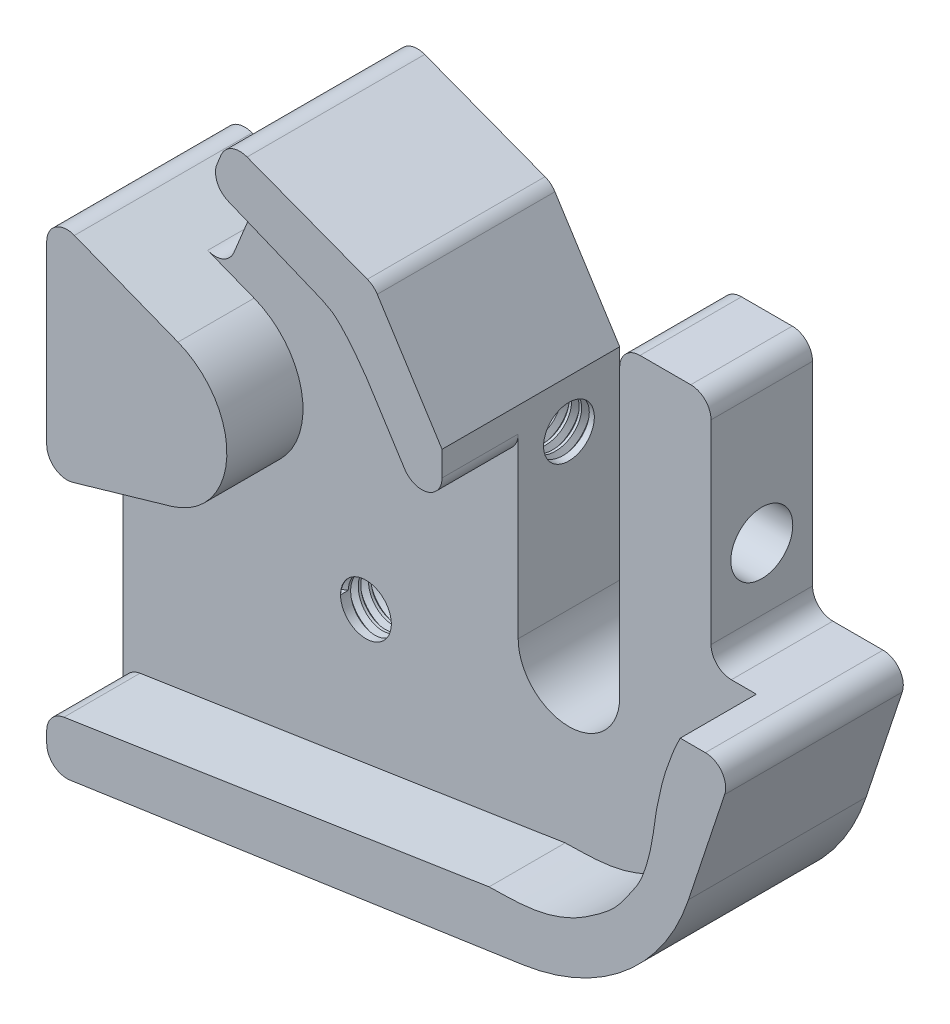
from build123d import *

# Parameters (mm, degrees)
BOSS_EXTRUDE1_DEPTH             = 10
BOSS_EXTRUDE2_DEPTH             = 17.5
SKETCH4_R                       = 3.0499999999999963
CUT_EXTRUDE2_DEPTH              = 30
TAP_DRILL_FOR_M6X1_0_TAP3_D     = 5
TAP_DRILL_FOR_M6X1_0_TAP3_DEPTH = 30
TAP_DRILL_FOR_M6X1_0_TAP3_TIP   = 1.5021515475689007
THREAD2_PITCH                   = 1
TAP_DRILL_FOR_M6X1_0_TAP4_D     = 5
TAP_DRILL_FOR_M6X1_0_TAP4_DEPTH = 30
TAP_DRILL_FOR_M6X1_0_TAP4_TIP   = 1.5021515475689007
THREAD3_PITCH                   = 1
FILLET1_R                       = 2


with BuildPart() as part:
    # Sketch1 → Boss-Extrude1 (new body)
    with BuildSketch(Plane.XY):
        with BuildLine():
            Line((78.96827475522947, 38.5935556342534), (78.96827475522947, 42.187825253742076))
            Line((78.96827475522947, 42.187825253742076), (77.94135898527813, 43.80236991179886))
            Line((77.94135898527813, 43.80236991179886), (74.33675739276399, 49.46962171171273))
            ThreePointArc((74.33675739276399, 49.469621711712726), (63.688772453091616, 32.62392036907067), (72.5745325100122, 14.785744867864917))
            Line((72.5745325100123, 14.785744867865446), (83.59996436724236, 16.48818112450211))
            add(Edge.make_bspline(
                [(83.59996436724236, 16.48818112450211), (85.41724211796232, 16.53756568760866), (87.87798883539779, 16.519220276594936), (90.67264688620305, 17.4205412675626), (92.39490917260517, 18.177313617681204), (94.09982159977741, 19.337279052052818), (95.76190532502257, 20.5841697393974), (96.83810880091103, 21.893388892292062), (97.57220809756222, 23.02149502182195), (98.2993424213877, 24.012698516640825), (98.8168110615546, 25.180735972728456), (99.338171414632, 26.79477159166982), (99.75451745291461, 28.733058812999758), (99.97921580397461, 30.8782343395527), (100.41119186805446, 32.87304752802449), (100.84339117053996, 34.69276986008277), (101.41680498340376, 36.208847575811006), (101.85717784527547, 37.44613777913256), (102.23335830846173, 38.17303090912299), (102.42203562576756, 38.57258948818352), (102.43189182699028, 38.59355563425273)],
                knots=[0, 0, 0, 0, 0.15768366072338366, 0.20676134981541355, 0.2516981863893839, 0.31900050382694334, 0.38365759589069376, 0.42951420214431174, 0.46378751400899093, 0.4995429911697522, 0.5348783172354219, 0.5730312186558052, 0.6454047552386061, 0.7048490244263054, 0.7583603601988523, 0.8208523578081605, 0.8654225677826217, 0.8976768321542437, 0.9336890739628735, 0.9356818003079899, 0.9356818003079899, 0.9356818003079899, 0.9356818003079899], degree=3))
            Line((102.4318918269901, 38.59355563425329), (97.96827475522947, 38.59355563425329))
            Line((97.96827475522947, 38.59355563425329), (88.96827475522947, 38.59355563425329))
            Line((88.96827475522946, 38.59355563425329), (88.96827475522947, 31.5935556342533))
            Line((88.96827475522947, 31.5935556342533), (88.96827475522947, 26.59355563425329))
            Line((88.96827475522947, 26.59355563425329), (83.96827475522934, 26.59355563425329))
            Line((83.96827475522934, 26.59355563425329), (78.96827475522947, 26.59355563425329))
            Line((78.96827475522947, 26.59355563425329), (78.96827475522947, 31.5935556342533))
            Line((78.96827475522947, 31.5935556342533), (78.96827475522947, 38.5935556342534))
        make_face()
        with BuildLine():
            Line((88.96827475522946, 51.27399935661806), (88.96827475522946, 43.59355563425329))
            Line((88.96827475522946, 43.59355563425329), (88.96827475522946, 38.59355563425329))
            Line((88.96827475522947, 38.59355563425329), (97.96827475522947, 38.59355563425329))
            Line((97.96827475522947, 38.59355563425329), (97.96827475522947, 40.58090115148971))
            Line((97.96827475522947, 40.58090115148971), (97.96827475522947, 46.30137209724829))
            ThreePointArc((97.96827475523008, 46.3013720972485), (93.78824193771862, 49.36679702810169), (88.96827475522964, 51.273999356618106))
        make_face()
        with BuildLine():
            Line((88.96827475522947, 61.76545821531718), (88.96827475522946, 51.27399935661806))
            ThreePointArc((88.96827475522964, 51.273999356618106), (93.78824193771862, 49.36679702810169), (97.96827475523008, 46.3013720972485))
            Line((97.96827475522947, 46.30137209724829), (97.96827475522947, 49.207587891809226))
            ThreePointArc((97.96827475522963, 49.20758789180928), (95.87453273292697, 54.36545821531696), (97.96827475522933, 59.52332853882476))
            Line((97.96827475522947, 59.523328538824714), (97.96827475522947, 61.76545821531719))
            Line((97.96827475522947, 61.76545821531719), (88.96827475522947, 61.76545821531718))
        make_face()
        with BuildLine():
            Line((88.96827475522947, 26.59355563425329), (88.96827475522947, 31.5935556342533))
            ThreePointArc((88.96827475522946, 31.5935556342533), (87.50380866116215, 28.058021728320522), (83.96827475522934, 26.59355563425331))
            Line((83.96827475522934, 26.59355563425329), (88.96827475522947, 26.59355563425329))
        make_face()
        with BuildLine():
            ThreePointArc((83.96827475522934, 26.59355563425331), (80.43274084929669, 28.058021728320615), (78.96827475522949, 31.5935556342533))
            Line((78.96827475522947, 31.5935556342533), (78.96827475522947, 26.59355563425329))
            Line((78.96827475522947, 26.59355563425329), (83.96827475522934, 26.59355563425329))
        make_face()
        with BuildLine():
            ThreePointArc((72.5745325100122, 14.785744867864917), (63.688772453091616, 32.62392036907067), (74.33675739276399, 49.469621711712726))
            Line((74.33675739276399, 49.46962171171273), (71.54074542683735, 53.865587102003296))
            add(Edge.make_bspline(
                [(67.16681294608784, 58.3330475317527), (67.53066578937491, 58.148158454940294), (68.2162670427706, 57.82971775359929), (69.73754280760359, 56.33759113466664), (70.76711290567232, 54.99803586851413), (71.54074542683735, 53.865587102003296)],
                knots=[0, 0, 0, 0, 0.19417637174294056, 0.35338295041403034, 1, 1, 1, 1], degree=3))
            Line((67.16681294608784, 58.3330475317527), (56.03811631838445, 62.90331689854259))
            Line((56.03811631838445, 62.90331689854259), (50.21233359803197, 48.7174203330503))
            Line((50.21233359803197, 48.7174203330503), (52.95464713088683, 47.643030748312306))
            ThreePointArc((52.95464713088681, 47.64303074831224), (56.45026737101809, 44.85792603920894), (57.76830437309072, 40.58721795212874))
            ThreePointArc((57.76830437309072, 40.58721795212874), (56.24935802543311, 36.03595953446999), (52.30143900683574, 33.30922401118043))
            Line((52.30143900683574, 33.30922401118043), (40.01978708427511, 29.746673468318164))
            Line((40.019787084275116, 29.746673468318164), (40.019787084275116, 9.758968623993628))
            Line((40.019787084275116, 9.758968623993628), (72.5745325100123, 14.785744867865446))
        make_face()
        with BuildLine():
            ThreePointArc((97.96827475522933, 59.52332853882476), (95.87453273292697, 54.36545821531696), (97.96827475522963, 49.20758789180928))
            Line((97.96827475522947, 49.207587891809226), (97.96827475522947, 59.523328538824714))
        make_face()
    extrude(amount=BOSS_EXTRUDE1_DEPTH)

    # Sketch1<3> → Boss-Extrude2 (add)
    with BuildSketch(Plane.XY):
        with BuildLine():
            Line((78.96827475522947, 42.187825253742076), (78.96827475522947, 43.59355563425329))
            Line((78.96827475522947, 43.59355563425329), (78.96827475522947, 49.44154603091854))
            Line((78.96827475522947, 49.44154603091854), (78.96827475522947, 51.27399935661824))
            ThreePointArc((78.96827475522967, 51.27399935661819), (76.59709644010309, 50.514062904297106), (74.33675739276399, 49.469621711712726))
            Line((74.33675739276399, 49.46962171171273), (77.94135898527813, 43.80236991179886))
            Line((77.94135898527813, 43.80236991179886), (78.96827475522947, 42.187825253742076))
        make_face()
        with BuildLine():
            ThreePointArc((74.33675739276399, 49.469621711712726), (76.59709644010309, 50.514062904297106), (78.96827475522967, 51.27399935661819))
            Line((78.96827475522947, 51.27399935661824), (78.96827475522947, 51.504339637287444))
            Line((78.96827475522947, 51.504339637287444), (77.99321410117432, 53.03735628417434))
            Line((77.99321410117432, 53.03735628417434), (72.23104068023561, 62.09680067854197))
            Line((72.2310406802356, 62.09680067854197), (70.50082285395956, 62.75430218344684))
            Line((70.50082285395956, 62.75430218344684), (57.93755222306168, 67.52848103011922))
            Line((57.93755222306168, 67.52848103011922), (56.03811631838445, 62.90331689854259))
            Line((56.03811631838445, 62.90331689854259), (67.16681294608784, 58.3330475317527))
            add(Edge.make_bspline(
                [(67.16681294608784, 58.3330475317527), (67.53066578937491, 58.148158454940294), (68.2162670427706, 57.82971775359929), (69.73754280760359, 56.33759113466664), (70.76711290567232, 54.99803586851413), (71.54074542683735, 53.865587102003296)],
                knots=[0, 0, 0, 0, 0.19417637174294056, 0.35338295041403034, 1, 1, 1, 1], degree=3))
            Line((71.54074542683735, 53.865587102003296), (74.33675739276399, 49.46962171171273))
        make_face()
        with BuildLine():
            Line((103.02922607223286, 38.59355563425329), (102.4318918269901, 38.59355563425329))
            add(Edge.make_bspline(
                [(83.59996436724236, 16.48818112450211), (85.41724211796232, 16.53756568760866), (87.87798883539779, 16.519220276594936), (90.67264688620305, 17.4205412675626), (92.39490917260517, 18.177313617681204), (94.09982159977741, 19.337279052052818), (95.76190532502257, 20.5841697393974), (96.83810880091103, 21.893388892292062), (97.57220809756222, 23.02149502182195), (98.2993424213877, 24.012698516640825), (98.8168110615546, 25.180735972728456), (99.338171414632, 26.79477159166982), (99.75451745291461, 28.733058812999758), (99.97921580397461, 30.8782343395527), (100.41119186805446, 32.87304752802449), (100.84339117053996, 34.69276986008277), (101.41680498340376, 36.208847575811006), (101.85717784527547, 37.44613777913256), (102.23335830846173, 38.17303090912299), (102.42203562576756, 38.57258948818352), (102.43189182699028, 38.59355563425273)],
                knots=[0, 0, 0, 0, 0.15768366072338366, 0.20676134981541355, 0.2516981863893839, 0.31900050382694334, 0.38365759589069376, 0.42951420214431174, 0.46378751400899093, 0.4995429911697522, 0.5348783172354219, 0.5730312186558052, 0.6454047552386061, 0.7048490244263054, 0.7583603601988523, 0.8208523578081605, 0.8654225677826217, 0.8976768321542437, 0.9336890739628735, 0.9356818003079899, 0.9356818003079899, 0.9356818003079899, 0.9356818003079899], degree=3))
            Line((83.59996436724236, 16.48818112450211), (72.5745325100123, 14.785744867865446))
            ThreePointArc((72.5745325100122, 14.785744867864917), (79.43931899005581, 11.799404357013096), (86.91969219864855, 11.50353323048651))
            ThreePointArc((86.91969219864855, 11.50353323048651), (97.02458391328798, 16.041942975806347), (103.24393044408335, 25.208497852688204))
            ThreePointArc((103.24393044408335, 25.208497852688204), (104.01478060289041, 28.359754711366204), (104.27393566811703, 31.593555634253295))
            ThreePointArc((104.27393566811703, 31.5935556342533), (103.96033667026586, 35.14845724956153), (103.02922607223283, 38.593555634253164))
        make_face()
        with BuildLine():
            ThreePointArc((86.91969219864855, 11.50353323048651), (79.43931899005581, 11.799404357013096), (72.5745325100122, 14.785744867864917))
            Line((72.5745325100123, 14.785744867865446), (40.019787084275116, 9.758968623993628))
            Line((40.019787084275116, 9.758968623993628), (40.019787084275116, 4.613486235158945))
            Line((40.019787084275116, 4.6134862351589465), (86.91969219864855, 11.50353323048651))
        make_face()
        with BuildLine():
            Line((107.67772976593382, 38.59355563425329), (103.02922607223286, 38.59355563425329))
            ThreePointArc((103.02922607223283, 38.593555634253164), (103.96033667026586, 35.14845724956153), (104.27393566811703, 31.5935556342533))
            ThreePointArc((104.27393566811703, 31.593555634253295), (104.01478060289041, 28.359754711366204), (103.24393044408335, 25.208497852688204))
            Line((103.24393044408342, 25.208497852688183), (107.67772976593382, 38.59355563425329))
        make_face()
        with BuildLine():
            Line((40.019787084275116, 35.746673468318164), (40.019787084275116, 29.746673468318164))
            Line((40.01978708427511, 29.746673468318164), (52.30143900683574, 33.30922401118043))
            ThreePointArc((52.30143900683574, 33.30922401118043), (47.364634323302816, 33.55574050130448), (43.63005434703988, 36.79390715299979))
            Line((43.63005434703988, 36.79390715299979), (40.01978708427511, 35.74667346831816))
        make_face()
        with BuildLine():
            Line((52.95464713088683, 47.643030748312306), (50.21233359803197, 48.7174203330503))
            Line((50.21233359803197, 48.7174203330503), (40.01978708427513, 52.710678465331654))
            Line((40.01978708427513, 52.71067846533165), (40.01978708427513, 47.34063824296787))
            Line((40.01978708427513, 47.34063824296787), (44.49575262392416, 45.58703468895018))
            ThreePointArc((44.49575262392417, 45.58703468895018), (48.4005247200828, 47.95082949329833), (52.95464713088681, 47.64303074831224))
        make_face()
        with BuildLine():
            ThreePointArc((43.63005434703988, 36.79390715299979), (47.364634323302816, 33.55574050130448), (52.30143900683574, 33.30922401118043))
            ThreePointArc((52.30143900683574, 33.30922401118043), (56.24935802543311, 36.03595953446999), (57.76830437309072, 40.58721795212874))
            ThreePointArc((57.76830437309072, 40.58721795212874), (56.45026737101809, 44.85792603920894), (52.95464713088681, 47.64303074831224))
            ThreePointArc((52.95464713088681, 47.64303074831224), (48.4005247200828, 47.95082949329833), (44.49575262392417, 45.58703468895018))
            ThreePointArc((44.49575262392417, 45.58703468895018), (42.648765078906784, 41.32969523869845), (43.63005434703988, 36.79390715299979))
        make_face()
        with BuildLine():
            Line((40.01978708427513, 47.34063824296787), (40.019787084275116, 35.746673468318164))
            Line((40.01978708427511, 35.74667346831816), (43.63005434703988, 36.79390715299979))
            ThreePointArc((43.63005434703988, 36.79390715299979), (42.648765078906784, 41.32969523869845), (44.49575262392417, 45.58703468895018))
            Line((44.49575262392416, 45.58703468895018), (40.01978708427513, 47.34063824296787))
        make_face()
    extrude(amount=BOSS_EXTRUDE2_DEPTH)

    # Sketch4 → Cut-Extrude2 (cut)
    with BuildSketch(Plane.ZY.offset(-88.9682747552295)):
        with Locations((5.000000000000002, 46.76545821531712)):
            Circle(SKETCH4_R)
    extrude(amount=-CUT_EXTRUDE2_DEPTH, mode=Mode.SUBTRACT)

    # Tap Drill for M6x1.0 Tap3
    with Locations(Plane(origin=(88.968274755, 46.765458215, 5), x_dir=(0, 1, 0), z_dir=(1, 0, 0))):
        with Locations((0, 0)):
            Hole(TAP_DRILL_FOR_M6X1_0_TAP3_D / 2, depth=TAP_DRILL_FOR_M6X1_0_TAP3_DEPTH)
            with Locations((0, 0, -(TAP_DRILL_FOR_M6X1_0_TAP3_DEPTH + TAP_DRILL_FOR_M6X1_0_TAP3_TIP / 2))):  # 118° drill point
                Cone(0, TAP_DRILL_FOR_M6X1_0_TAP3_D / 2, TAP_DRILL_FOR_M6X1_0_TAP3_TIP, mode=Mode.SUBTRACT)

    # Thread2: the profile of Thread Profile2 profile screwed along a right-hand helix of 20 turns, 8 arcs to a turn; built about Z, then put on its axis
    thread2_z = Axis((0, 0, 0), (0, 0, 1))
    thread2_corners = [(2.4997, 0, -0.000173205), (3.041265875, 0, 0.312499998), (3.041265875, 0, 0.437499998), (2.4997, 0, 0.750173202)]
    with BuildLine(mode=Mode.PRIVATE) as thread2_profile:
        Line(thread2_corners[0], thread2_corners[1])
        Line(thread2_corners[1], thread2_corners[2])
        Line(thread2_corners[2], thread2_corners[3])
        Line(thread2_corners[3], thread2_corners[0])
    thread2_cap = Face(thread2_profile.wire())
    thread2_turn_angles = [0, 22.5, 45, 67.5, 90, 112.5, 135, 157.5, 180, 202.5, 225, 247.5, 270, 292.5, 315, 337.5, 360]
    thread2_turn_weights = [1, 0.9238795325112867, 1, 0.9238795325112867, 1, 0.9238795325112867, 1, 0.9238795325112867, 1, 0.9238795325112867, 1, 0.9238795325112867, 1, 0.9238795325112867, 1, 0.9238795325112867, 1]
    thread2_turn_rails = [Edge.make_bspline([Vector(p[0], p[1], 0).rotate(thread2_z, thread2_turn_angles[k]) / thread2_turn_weights[k] + Vector(0, 0, p[2] + THREAD2_PITCH * thread2_turn_angles[k] / 360) for k in range(17)], [0, 0, 0, 1, 1, 2, 2, 3, 3, 4, 4, 5, 5, 6, 6, 7, 7, 8, 8, 8], 2, thread2_turn_weights) for p in thread2_corners]
    thread2_turn_sides = [Face.make_surface_from_curves(thread2_turn_rails[p[0]], thread2_turn_rails[p[1]]) for p in [(0, 1), (1, 2), (2, 3), (3, 0)]]
    thread2 = Plane(origin=(78.968274755, 46.765458215, 5), x_dir=(0, 0, 1), z_dir=(-1, 0, 0)) * Solid(Shell([*[p.moved(Location((0, 0, THREAD2_PITCH * i))) for i in range(20) for p in thread2_turn_sides], thread2_cap, thread2_cap.rotate(thread2_z, 7200).moved(Location((0, 0, THREAD2_PITCH * 7200 / 360)))]))
    add(thread2, mode=Mode.SUBTRACT)

    # Tap Drill for M6x1.0 Tap4
    with Locations(Plane(origin=(63.968274755, 26.593555634, 10), x_dir=(1, 0, 0), z_dir=(0, 0, 1))):
        with Locations((0, 0)):
            Hole(TAP_DRILL_FOR_M6X1_0_TAP4_D / 2, depth=TAP_DRILL_FOR_M6X1_0_TAP4_DEPTH)
            with Locations((0, 0, -(TAP_DRILL_FOR_M6X1_0_TAP4_DEPTH + TAP_DRILL_FOR_M6X1_0_TAP4_TIP / 2))):  # 118° drill point
                Cone(0, TAP_DRILL_FOR_M6X1_0_TAP4_D / 2, TAP_DRILL_FOR_M6X1_0_TAP4_TIP, mode=Mode.SUBTRACT)

    # Thread3: the profile of Thread Profile3 profile screwed along a right-hand helix of 20 turns, 8 arcs to a turn; built about Z, then put on its axis
    thread3_z = Axis((0, 0, 0), (0, 0, 1))
    thread3_corners = [(2.4997, 0, -0.000173205), (3.041265875, 0, 0.312499999), (3.041265875, 0, 0.437499999), (2.4997, 0, 0.750173202)]
    with BuildLine(mode=Mode.PRIVATE) as thread3_profile:
        Line(thread3_corners[0], thread3_corners[1])
        Line(thread3_corners[1], thread3_corners[2])
        Line(thread3_corners[2], thread3_corners[3])
        Line(thread3_corners[3], thread3_corners[0])
    thread3_cap = Face(thread3_profile.wire())
    thread3_turn_angles = [0, 22.5, 45, 67.5, 90, 112.5, 135, 157.5, 180, 202.5, 225, 247.5, 270, 292.5, 315, 337.5, 360]
    thread3_turn_weights = [1, 0.9238795325112867, 1, 0.9238795325112867, 1, 0.9238795325112867, 1, 0.9238795325112867, 1, 0.9238795325112867, 1, 0.9238795325112867, 1, 0.9238795325112867, 1, 0.9238795325112867, 1]
    thread3_turn_rails = [Edge.make_bspline([Vector(p[0], p[1], 0).rotate(thread3_z, thread3_turn_angles[k]) / thread3_turn_weights[k] + Vector(0, 0, p[2] + THREAD3_PITCH * thread3_turn_angles[k] / 360) for k in range(17)], [0, 0, 0, 1, 1, 2, 2, 3, 3, 4, 4, 5, 5, 6, 6, 7, 7, 8, 8, 8], 2, thread3_turn_weights) for p in thread3_corners]
    thread3_turn_sides = [Face.make_surface_from_curves(thread3_turn_rails[p[0]], thread3_turn_rails[p[1]]) for p in [(0, 1), (1, 2), (2, 3), (3, 0)]]
    thread3 = Plane(origin=(63.968274755, 26.593555634, 10), x_dir=(-1, 0, 0), z_dir=(0, 0, -1)) * Solid(Shell([*[p.moved(Location((0, 0, THREAD3_PITCH * i))) for i in range(20) for p in thread3_turn_sides], thread3_cap, thread3_cap.rotate(thread3_z, 7200).moved(Location((0, 0, THREAD3_PITCH * 7200 / 360)))]))
    add(thread3, mode=Mode.SUBTRACT)

    # Fillet1
    fillet1_edges = [part.edges().sort_by_distance(p)[0] for p in [
        (97.96827475522947, 61.76545821531719, 5),
        (88.96827475522947, 61.76545821531718, 5),
        (57.93755222306168, 67.52848103011922, 8.75),
        (56.03811631838445, 62.90331689854259, 13.75),
        (78.96827475522947, 42.187825253742076, 13.75),
        (50.21233359803197, 48.7174203330503, 5),
        (40.019787084275116, 4.613486235158946, 8.75),
        (40.019787084275116, 9.758968623993628, 13.75),
        (40.01978708427511, 29.746673468318164, 13.75),
        (40.01978708427513, 52.710678465331654, 8.75),
        (72.2310406802356, 62.09680067854197, 8.75),
        (107.67772976593382, 38.59355563425329, 8.75),
        (97.96827475522947, 38.59355563425329, 5),
    ]]
    fillet(fillet1_edges, radius=FILLET1_R)


solid = part.part
